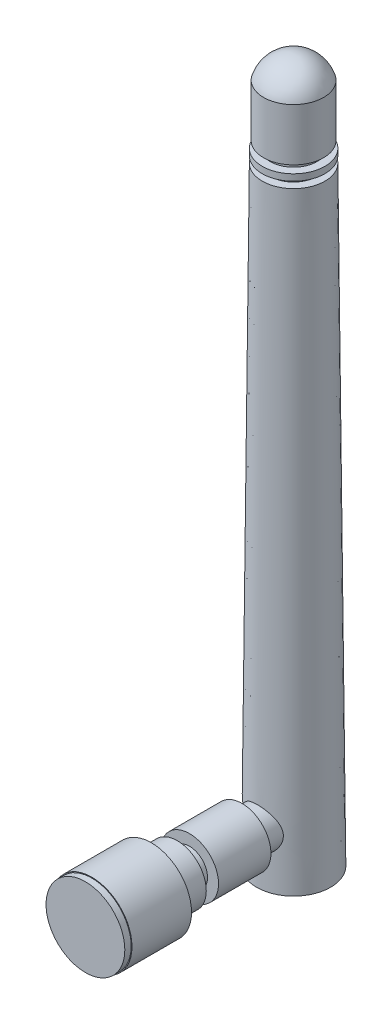
from build123d import *


with BuildPart() as part:
    # 草图1 → 旋转1 (revolve)
    with BuildSketch(Plane.XY):
        with BuildLine():
            Line((0, -8.871116041), (-4.6, -8.871116041))
            Line((-4.6, -8.871116041), (-3.9, 66.878718358))
            Line((-3.9, 66.878718358), (-2.9, 66.878718358))
            Line((-2.9, 66.878718358), (-2.9, 67.678718358))
            Line((-2.9, 67.678718358), (-3.9, 67.678718358))
            Line((-3.9, 67.678718358), (-3.9, 68.478718358))
            Line((-3.9, 68.478718358), (-2.9, 68.478718358))
            Line((-2.9, 68.478718358), (-2.9, 69.316506289))
            Line((-2.9, 69.316506289), (-3.735091076, 69.316506289))
            Line((-3.735091076, 69.316506289), (-3.735091076, 75.816506289))
            ThreePointArc((-3.735091076, 75.816506289), (-2.337753917, 77.847174239), (0, 78.628883959))
            Line((0, 78.628883959), (0, -8.871116041))
        make_face()
    revolve(axis=Axis((0, 100.774977187, 0), (0, -1, 0)))

    # 草图2 → Revolve 894 (revolve)
    with BuildSketch(Plane(origin=(0, 0, 0), x_dir=(0, 0, -1), z_dir=(1, 0, 0))):
        Polygon((0, 0), (-6.429276603, 0), (-6.429276603, 1.099364131), (-12.95, 1.099364131), (-12.95, -0.266872358), (-14.47347065, -0.266872358), (-14.47347065, 1.099364131), (-17.7, 1.099364131), (-17.7, 2.489950524), (-25.109397803, 2.489950524), (-25.109397803, 2.389950524), (-25.9, 2.389950524), (-25.9, -2.510049476), (0, -2.510049476), align=None)
    revolve(axis=Axis((0, -2.510049476, 44.503458482), (0, 0, -1)))


solid = part.part
